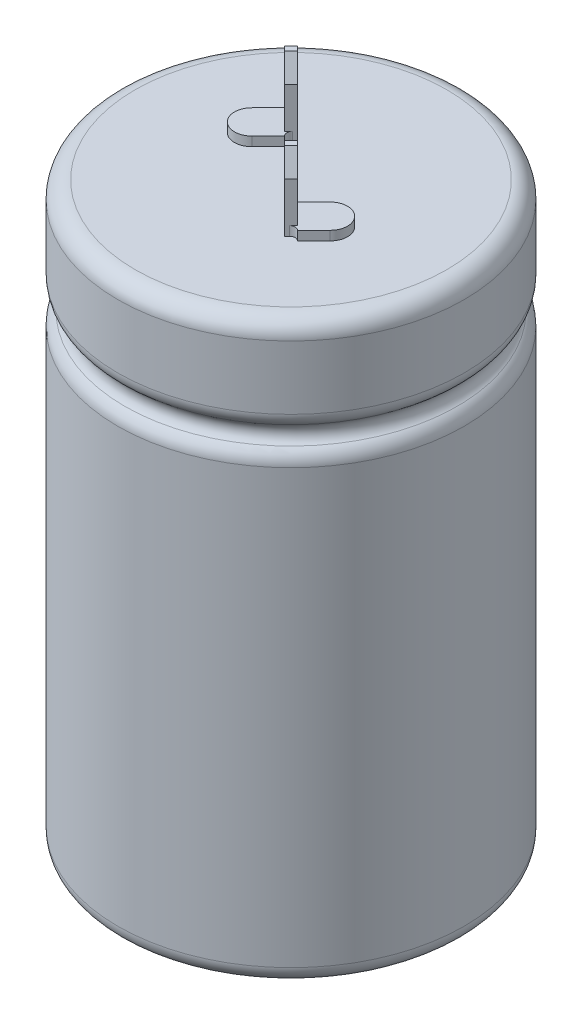
from build123d import *
from OCP.BRepFilletAPI import BRepFilletAPI_MakeChamfer

# Parameters (mm, degrees)
FILLET_1_R      = 1.5
EXTRUDE_4_DEPTH = 6.3
EXTRUDE_5_DEPTH = 0.8
CHAMFER_2_SIZE  = 2
CHAMFER_2_SIZE2 = 0.727940469
FILLET_4_R      = 0.5


with BuildPart() as part:
    # Эскиз2 → Повернуть1 (revolve)
    with BuildSketch(Plane.XY, mode=Mode.PRIVATE) as revolve_1_sk:
        with BuildLine():
            Line((0, 0), (-15, 0))
            Line((-15, 0), (-15, 40))
            ThreePointArc((-15, 40), (-14, 41), (-15, 42))
            Line((-15, 42), (-15, 50))
            Line((-15, 50), (0, 50))
            Line((0, 50), (0, 0))
        make_face()
    revolve(revolve_1_sk.sketch.rotate(Axis((0, 0, 0), (0, 1, 0)), 270), axis=Axis((0, 0, 0), (0, 1, 0)))

    # Скругление1
    fillet_1_edges = [part.edges().sort_by_distance(p)[0] for p in [
        (0, 0, 15),
        (0, 40, 15),
        (0, 42, 15),
        (0, 50, 15),
    ]]
    fillet(fillet_1_edges, radius=FILLET_1_R)

    # Эскиз3 → Бобышка-Вытянуть4 (add)
    with BuildSketch(Plane(origin=(0, 50, 0), x_dir=(1, 0, 0), z_dir=(0, 1, 0))):
        Polygon((-4.5254834, 3.959797975), (-3.111269837, 2.545584412), (-2.545584412, 3.111269837), (-3.959797975, 4.5254834), align=None)
        Polygon((3.959797975, -4.5254834), (2.545584412, -3.111269837), (3.111269837, -2.545584412), (4.5254834, -3.959797975), align=None)
    extrude(amount=EXTRUDE_4_DEPTH)

    # Эскиз5 → Бобышка-Вытянуть5 (add)
    with BuildSketch(Plane(origin=(0, 50, 0), x_dir=(1, 0, 0), z_dir=(0, 1, 0))):
        with BuildLine():
            Line((-2.757716447, 2.192031022), (-4.87903679, 4.313351365))
            Line((-4.87903679, 4.313351365), (-6.293250353, 2.899137803))
            ThreePointArc((-6.293250353, 2.899137803), (-6.293250353, 0.777817459), (-4.171930009, 0.777817459))
            Line((-4.171930009, 0.777817459), (-2.757716447, 2.192031022))
        make_face()
        with BuildLine():
            Line((4.87903679, -4.313351365), (2.757716447, -2.192031022))
            Line((2.757716447, -2.192031022), (4.171930009, -0.777817459))
            ThreePointArc((4.171930009, -0.777817459), (6.293250353, -0.777817459), (6.293250353, -2.899137803))
            Line((6.293250353, -2.899137803), (4.87903679, -4.313351365))
        make_face()
    extrude(amount=EXTRUDE_5_DEPTH)

    # Фаска2: one chamfer whose edges measure the first distance from different faces: ONE call of the kernel's chamfer builder (chamfer() names one face for all edges)
    chamfer_2_edges_1 = [part.edges().sort_by_distance(p)[0] for p in [
        (-4.242640687, 56.3, -4.242640687),
    ]]
    chamfer_2_side_1 = [part.faces().sort_by_distance(p)[0] for p in [
        (-4.242640687, 53.15, -4.242640687),
    ]]
    chamfer_2_edges_2 = [part.edges().sort_by_distance(p)[0] for p in [
        (-2.828427125, 56.3, -2.828427125),
    ]]
    chamfer_2_side_2 = [part.faces().sort_by_distance(p)[0] for p in [
        (-2.828427125, 53.15, -2.828427125),
    ]]
    chamfer_2_edges_3 = [part.edges().sort_by_distance(p)[0] for p in [
        (4.242640687, 56.3, 4.242640687),
    ]]
    chamfer_2_side_3 = [part.faces().sort_by_distance(p)[0] for p in [
        (4.242640687, 53.15, 4.242640687),
    ]]
    chamfer_2_edges_4 = [part.edges().sort_by_distance(p)[0] for p in [
        (2.828427125, 56.3, 2.828427125),
    ]]
    chamfer_2_side_4 = [part.faces().sort_by_distance(p)[0] for p in [
        (2.828427125, 53.15, 2.828427125),
    ]]
    chamfer_2 = BRepFilletAPI_MakeChamfer(part.part.solid().wrapped)
    for e in chamfer_2_edges_1:
        chamfer_2.Add(CHAMFER_2_SIZE, CHAMFER_2_SIZE2, e.wrapped, chamfer_2_side_1[0].wrapped)  # the first distance lies on this face
    for e in chamfer_2_edges_2:
        chamfer_2.Add(CHAMFER_2_SIZE, CHAMFER_2_SIZE2, e.wrapped, chamfer_2_side_2[0].wrapped)  # the first distance lies on this face
    for e in chamfer_2_edges_3:
        chamfer_2.Add(CHAMFER_2_SIZE, CHAMFER_2_SIZE2, e.wrapped, chamfer_2_side_3[0].wrapped)  # the first distance lies on this face
    for e in chamfer_2_edges_4:
        chamfer_2.Add(CHAMFER_2_SIZE, CHAMFER_2_SIZE2, e.wrapped, chamfer_2_side_4[0].wrapped)  # the first distance lies on this face
    add(Compound.cast(chamfer_2.Shape()), mode=Mode.REPLACE)

    # Скругление4
    fillet_4_edges = [part.edges().sort_by_distance(p)[0] for p in [
        (3.111269837, 50.4, 2.545584412),
        (4.5254834, 50.4, 3.959797975),
        (-4.5254834, 50.4, -3.959797975),
        (-3.111269837, 50.4, -2.545584412),
    ]]
    fillet(fillet_4_edges, radius=FILLET_4_R - 0.0001)  # a hair under: the kernel refuses the full size


solid = part.part
